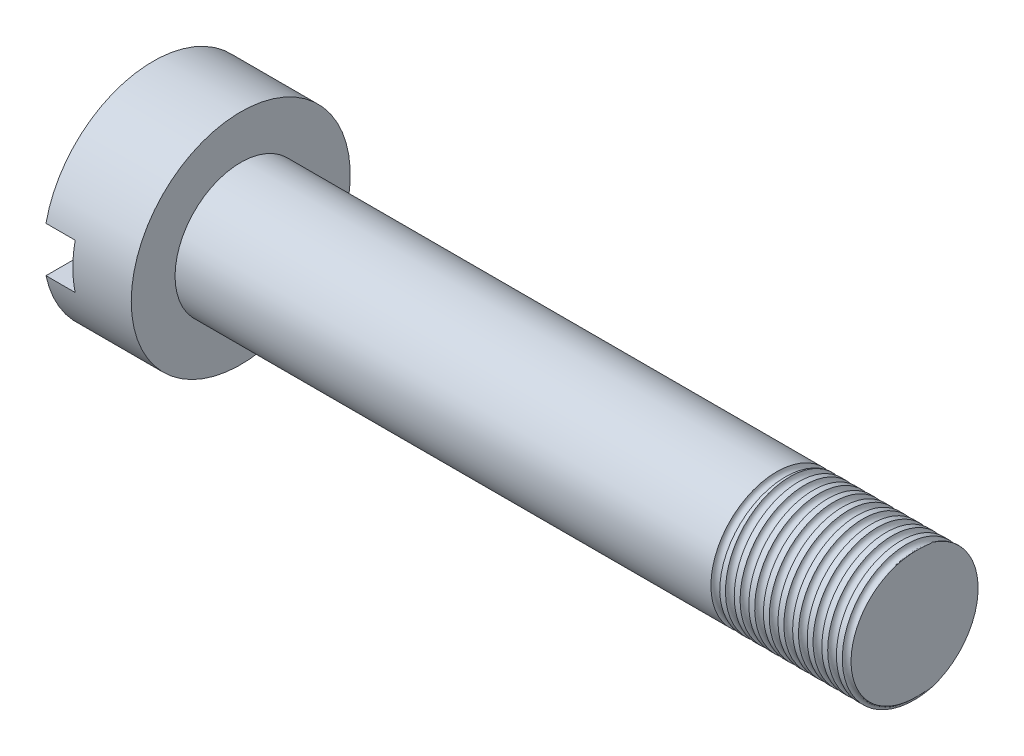
from build123d import *

# Parameters (mm, degrees)
SKETCH2_W          = 7.5
SKETCH2_H          = 1.551111602
CUT_EXTRUDE1_DEPTH = 1
CUT_SWEEP1_PITCH   = 0.5
SKETCH13_R         = 0.150697403


with BuildPart() as part:
    # Sketch1 → Revolve1 (revolve)
    with BuildSketch(Plane.XY, mode=Mode.PRIVATE) as revolve1_sk:
        Polygon((0.859744086, 0), (23, 0), (23, 2.25), (0, 2.25), (0, 3.75), (-3, 3.75), (-3, 0), align=None)
    revolve(revolve1_sk.sketch.rotate(Axis((-3, 0, 0), (1, 0, 0)), 90), axis=Axis((-3, 0, 0), (1, 0, 0)))

    # Sketch2 → Cut-Extrude1 (cut)
    with BuildSketch(Plane.ZY.offset(3)):
        Rectangle(SKETCH2_W, SKETCH2_H)
    extrude(amount=-CUT_EXTRUDE1_DEPTH, mode=Mode.SUBTRACT)

    # Cut-Sweep1: arcs per turn and ends read off the stored shape
    # Cut-Sweep1: the profile of Sketch11 screwed along a right-hand helix through 10 turns, 6 arcs to a turn; built about Z, then put on its axis
    cut_sweep1_z = Axis((0, 0, 0), (0, 0, 1))
    cut_sweep1_corners = [(2.25, 0, -0.65), (2.1, 0, -0.5), (2.25, 0, -0.35), (2.4, 0, -0.5)]
    with BuildLine(mode=Mode.PRIVATE) as cut_sweep1_profile:
        ThreePointArc((2.25, 0, -0.65), (2.143933983, 0, -0.606066017), (2.1, 0, -0.5))
        ThreePointArc((2.1, 0, -0.5), (2.143933983, 0, -0.393933983), (2.25, 0, -0.35))
        ThreePointArc((2.25, 0, -0.35), (2.356066017, 0, -0.393933983), (2.4, 0, -0.5))
        ThreePointArc((2.4, 0, -0.5), (2.356066017, 0, -0.606066017), (2.25, 0, -0.65))
    cut_sweep1_cap = Face(cut_sweep1_profile.wire())
    cut_sweep1_arcs = [((2.25, 0, -0.65), (2.1, 0, -0.65), (2.1, 0, -0.5), (1, 0.7071067811865476, 1)), ((2.1, 0, -0.5), (2.1, 0, -0.35), (2.25, 0, -0.35), (1, 0.7071067811865476, 1)), ((2.25, 0, -0.35), (2.4, 0, -0.35), (2.4, 0, -0.5), (1, 0.7071067811865476, 1)), ((2.4, 0, -0.5), (2.4, 0, -0.65), (2.25, 0, -0.65), (1, 0.7071067811865476, 1))]  # start, shoulder, end, weights
    cut_sweep1_turn_angles = [0, 30, 60, 90, 120, 150, 180, 210, 240, 270, 300, 330, 360]
    cut_sweep1_turn_weights = [1, 0.8660254037844387, 1, 0.8660254037844387, 1, 0.8660254037844387, 1, 0.8660254037844387, 1, 0.8660254037844387, 1, 0.8660254037844387, 1]
    cut_sweep1_turn_sides = [Face.make_bezier_surface([[Vector(p[j][0], p[j][1], 0).rotate(cut_sweep1_z, cut_sweep1_turn_angles[2 * i + k]) / cut_sweep1_turn_weights[2 * i + k] + Vector(0, 0, p[j][2] + CUT_SWEEP1_PITCH * cut_sweep1_turn_angles[2 * i + k] / 360) for k in range(3)] for j in range(3)], [[p[3][j] * cut_sweep1_turn_weights[2 * i + k] for k in range(3)] for j in range(3)]) for p in cut_sweep1_arcs for i in range(6)]
    cut_sweep1 = Plane(origin=(23, 0, 0), x_dir=(0, 0, 1), z_dir=(-1, 0, 0)) * Solid(Shell([*[p.moved(Location((0, 0, CUT_SWEEP1_PITCH * i))) for i in range(10) for p in cut_sweep1_turn_sides], cut_sweep1_cap, cut_sweep1_cap.rotate(cut_sweep1_z, 3600).moved(Location((0, 0, CUT_SWEEP1_PITCH * 3600 / 360)))]))
    add(cut_sweep1, mode=Mode.SUBTRACT)

    # Sketch13 → Cut-Revolve2 (revolve, cut)
    with BuildSketch(Plane(origin=(0, 0, 0), x_dir=(-1, 0, 0), z_dir=(0, -1, 0)), mode=Mode.PRIVATE) as cut_revolve2_sk:
        with Locations((-18.500692552, -2.248790905)):
            Circle(SKETCH13_R)
    revolve(cut_revolve2_sk.sketch.rotate(Axis((25.300376325, 0, 0), (-1, 0, 0)), 180), axis=Axis((25.300376325, 0, 0), (-1, 0, 0)), mode=Mode.SUBTRACT)


solid = part.part
